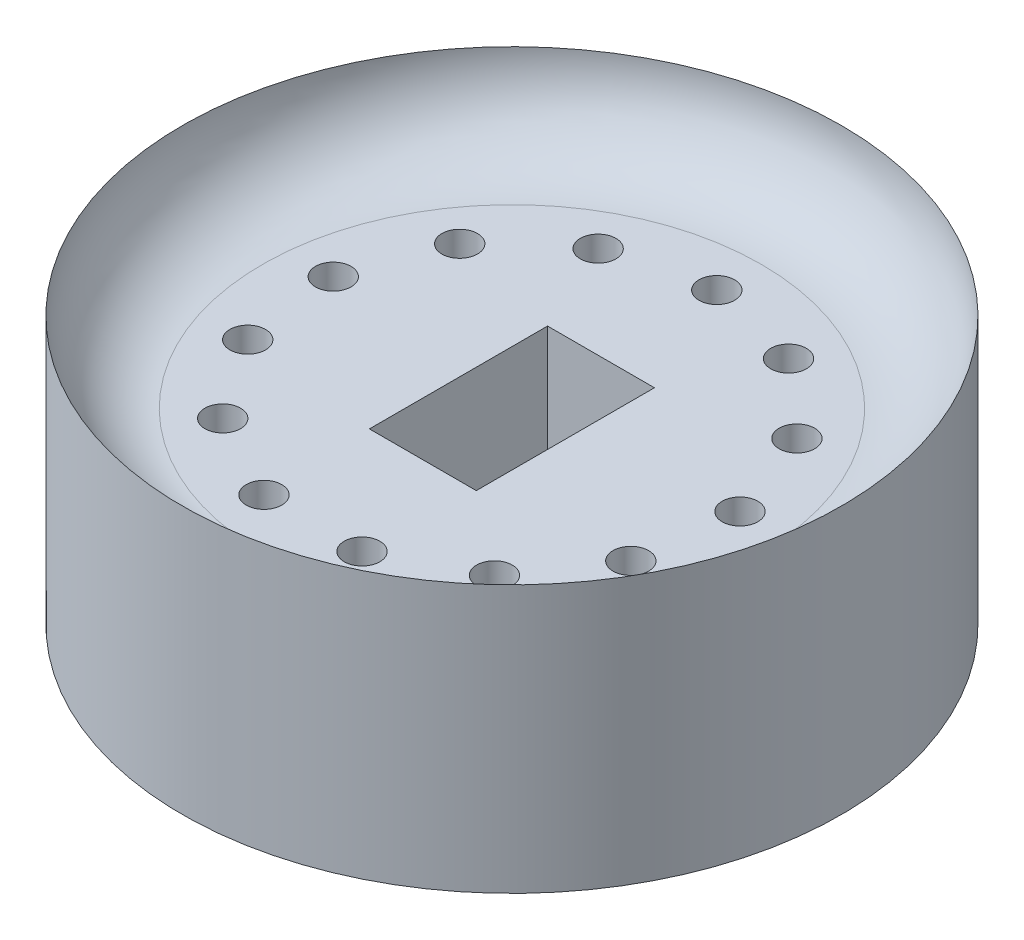
from build123d import *

# Parameters (mm, degrees)
CROQUIS2_R            = 0.5
CROQUIS2_W            = 3
CROQUIS2_H            = 5
CORTAR_EXTRUIR1_DEPTH = 15.095655359


with BuildPart() as part:
    # Croquis1 → Revolución3 (revolve)
    with BuildSketch(Plane.XY):
        with BuildLine():
            ThreePointArc((9.25, 7.5), (8.590990258, 5.909009742), (7, 5.25))
            Line((7, 5.25), (0, 5.25))
            Line((0, 5.25), (0, 0))
            Line((0, 0), (9.25, 0))
            Line((9.25, 0), (9.25, 7.5))
        make_face()
    revolve(axis=Axis((0, 0, 0), (0, 1, 0)))

    # Croquis2 → Cortar-Extruir1 (cut, through all)
    with BuildSketch(Plane(origin=(0, 5.25, 0), x_dir=(1, 0, 0), z_dir=(0, 1, 0))):
        with Locations((0, 5.75)):
            Circle(CROQUIS2_R)
        with Locations((2.672158239, 5.091372148)):
            Circle(CROQUIS2_R)
        with Locations((4.732157229, 3.266372294)):
            Circle(CROQUIS2_R)
        with Locations((5.708076026, 0.693085911)):
            Circle(CROQUIS2_R)
        with Locations((5.376343395, -2.0389781)):
            Circle(CROQUIS2_R)
        with Locations((3.812955285, -4.303936802)):
            Circle(CROQUIS2_R)
        with Locations((1.37606507, -5.58291545)):
            Circle(CROQUIS2_R)
        with Locations((-1.37606507, -5.58291545)):
            Circle(CROQUIS2_R)
        with Locations((-3.812955285, -4.303936802)):
            Circle(CROQUIS2_R)
        with Locations((-5.376343395, -2.0389781)):
            Circle(CROQUIS2_R)
        with Locations((-5.708076026, 0.693085911)):
            Circle(CROQUIS2_R)
        with Locations((-4.732157229, 3.266372294)):
            Circle(CROQUIS2_R)
        with Locations((-2.672158239, 5.091372148)):
            Circle(CROQUIS2_R)
        Rectangle(CROQUIS2_W, CROQUIS2_H)
    extrude(amount=-CORTAR_EXTRUIR1_DEPTH, mode=Mode.SUBTRACT)


solid = part.part
